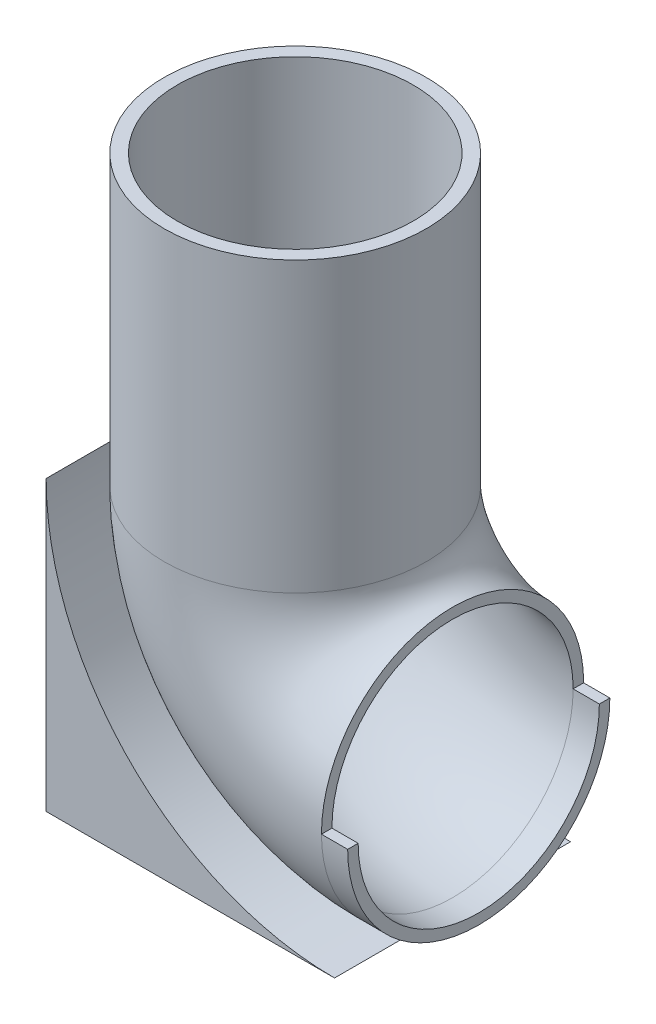
from build123d import *

# Parameters (mm, degrees)
SKETCH2_R               = 25
SKETCH2_R_2             = 22.5
BOSS_EXTRUDE1_DEPTH     = 55
SKETCH3_R               = 25
REVOLVE1_ANGLE          = 90
SKETCH4_R               = 25
BOSS_EXTRUDE2_DEPTH     = 5
VACIADO1_T              = -2
CORTAR_EXTRUIR1_DEPTH   = 5
SALIENTE_EXTRUIR2_DEPTH = 22.5
CROQUIS3_R              = 4
CORTAR_EXTRUIR2_DEPTH   = 6
CORTAR_EXTRUIR3_START   = -2
CROQUIS4_R              = 22.5
CORTAR_EXTRUIR3_DEPTH   = 2


with BuildPart() as part:
    # Sketch2 → Boss-Extrude1 (new body)
    with BuildSketch(Plane(origin=(0, 0, 0), x_dir=(1, 0, 0), z_dir=(0, 1, 0))):
        Circle(SKETCH2_R)
        Circle(SKETCH2_R_2, mode=Mode.SUBTRACT)
    extrude(amount=BOSS_EXTRUDE1_DEPTH)

    # Sketch3 → Revolve1 (revolve)
    with BuildSketch(Plane(origin=(0, 0, 0), x_dir=(1, 0, 0), z_dir=(0, 1, 0))):
        Circle(SKETCH3_R)
    revolve(axis=Axis((30, 0, -21.726770061), (0, 0, 1)), revolution_arc=REVOLVE1_ANGLE)

    # Sketch4 → Boss-Extrude2 (add)
    with BuildSketch(Plane(origin=(30, 0, 0), x_dir=(0, 0, -1), z_dir=(1, 0, 0))):
        with Locations((0, -30)):
            Circle(SKETCH4_R)
    extrude(amount=BOSS_EXTRUDE2_DEPTH)

    # Vaciado1
    vaciado1_openings = [part.faces().sort_by_distance(p)[0] for p in [
        (35, -30, 0),
    ]]
    offset(amount=VACIADO1_T, openings=vaciado1_openings, kind=Kind.INTERSECTION)

    # Croquis1 → Cortar-Extruir1 (cut)
    with BuildSketch(Plane(origin=(35, 0, 0), x_dir=(0, 0, -1), z_dir=(1, 0, 0))):
        with BuildLine():
            Line((-25, -30), (25, -30))
            ThreePointArc((25, -30), (0, 0.962643483), (-25, -30))
        make_face()
    extrude(amount=-CORTAR_EXTRUIR1_DEPTH, mode=Mode.SUBTRACT)

    # Croquis4 → Cortar-Extruir3 (cut)
    with BuildSketch(Plane(origin=(0, 0, 0), x_dir=(1, 0, 0), z_dir=(0, 1, 0)).offset(CORTAR_EXTRUIR3_START)):
        Circle(CROQUIS4_R)
    extrude(amount=CORTAR_EXTRUIR3_DEPTH, mode=Mode.SUBTRACT)


with BuildPart() as body_2:
    # Croquis3D2 → Saliente-Extruir2 (new, symmetric)
    with BuildSketch(Plane(origin=(-25, 0, 0), x_dir=(0.7071067811865489, -0.7071067811865462, 0), z_dir=(0, 0, -1))):
        with BuildLine():
            Line((0, 0), (38.890872965, 38.890872965))
            Line((38.890872965, 38.890872965), (77.781745931, 0))
            ThreePointArc((77.781745931, 0), (38.890872965, 16.109127035), (0, 0))
        make_face()
    extrude(amount=SALIENTE_EXTRUIR2_DEPTH, both=True)

    # Croquis3 → Cortar-Extruir2 (cut)
    with BuildSketch(Plane(origin=(0, -55, 0), x_dir=(-1, 0, 0), z_dir=(0, -1, 0))):
        with Locations((10, -15)):
            Circle(CROQUIS3_R)
        with Locations((10, 15)):
            Circle(CROQUIS3_R)
    extrude(amount=-CORTAR_EXTRUIR2_DEPTH, mode=Mode.SUBTRACT)


solid = Compound([part.part, body_2.part])
